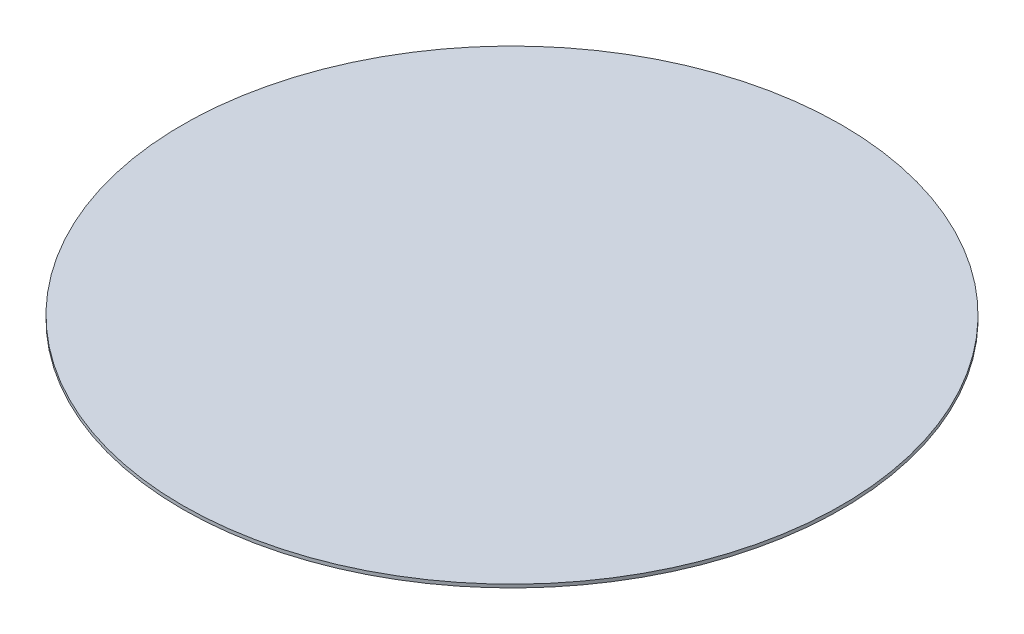
from build123d import *

# Parameters (mm, degrees)
SKETCH1_R           = 100
BOSS_EXTRUDE1_DEPTH = 1


with BuildPart() as part:
    # Sketch1 → Boss-Extrude1 (new body)
    with BuildSketch(Plane(origin=(0, 0, 0), x_dir=(1, 0, 0), z_dir=(0, 1, 0))):
        Circle(SKETCH1_R)
    extrude(amount=BOSS_EXTRUDE1_DEPTH)


solid = part.part
